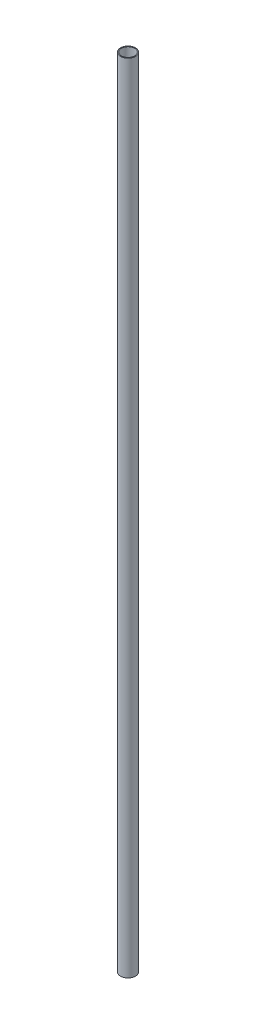
from build123d import *

# Parameters (mm, degrees)
SKETCH1_R           = 3.81
SKETCH1_R_2         = 3.3655
BOSS_EXTRUDE1_DEPTH = 406.4


with BuildPart() as part:
    # Sketch1 → Boss-Extrude1 (new body)
    with BuildSketch(Plane(origin=(0, 0, 0), x_dir=(1, 0, 0), z_dir=(0, 1, 0))):
        Circle(SKETCH1_R)
        Circle(SKETCH1_R_2, mode=Mode.SUBTRACT)
    extrude(amount=BOSS_EXTRUDE1_DEPTH)


solid = part.part
